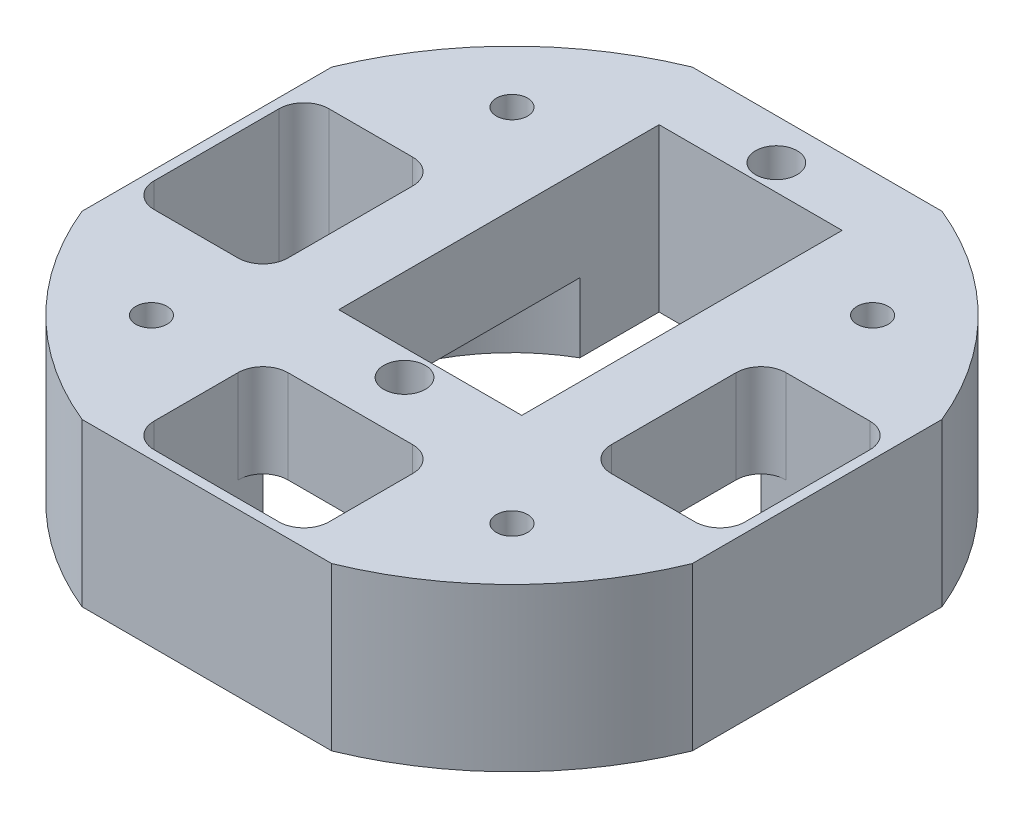
from build123d import *

# Parameters (mm, degrees)
SKETCH2_R           = 1.125
SKETCH2_R_2         = 1.5
SKETCH2_W           = 13.2
SKETCH2_H           = 23.1
BOSS_EXTRUDE3_DEPTH = 11.7
SKETCH2_9_R         = 1.5
CUT_EXTRUDE3_DEPTH  = 5
FILLET1_R           = 1.8


with BuildPart() as part:
    # Sketch2 → Boss-Extrude3 (new body)
    with BuildSketch(Plane(origin=(0, 0, 0), x_dir=(1, 0, 0), z_dir=(0, 1, 0))):
        with BuildLine():
            ThreePointArc((9, -22), (16.807736314, -16.807736314), (22, -9))
            Line((22, -9), (22, 9))
            ThreePointArc((22, 9), (16.807736314, 16.807736314), (9, 22))
            Line((9, 22), (-9, 22))
            ThreePointArc((-9, 22), (-16.807736314, 16.807736314), (-22, 9))
            Line((-22, 9), (-22, -9))
            ThreePointArc((-22, -9), (-16.807736314, -16.807736314), (-9, -22))
            Line((-9, -22), (9, -22))
        make_face()
        with BuildLine():
            Line((-6.3, -19.5), (-6.3, -11.65643599))
            Line((-6.3, -11.65643599), (6.3, -11.65643599))
            Line((6.3, -11.65643599), (6.3, -19.5))
            ThreePointArc((6.3, -19.5), (5.772792206, -20.772792206), (4.5, -21.3))
            Line((4.5, -21.3), (-4.5, -21.3))
            ThreePointArc((-4.5, -21.3), (-5.772792206, -20.772792206), (-6.3, -19.5))
        make_face(mode=Mode.SUBTRACT)
        with BuildLine():
            Line((-19.5, 6.3), (-11.65643599, 6.3))
            Line((-11.65643599, 6.3), (-11.65643599, -6.3))
            Line((-11.65643599, -6.3), (-19.5, -6.3))
            ThreePointArc((-19.5, -6.3), (-20.772792206, -5.772792206), (-21.3, -4.5))
            Line((-21.3, -4.5), (-21.3, 4.5))
            ThreePointArc((-21.3, 4.5), (-20.772792206, 5.772792206), (-19.5, 6.3))
        make_face(mode=Mode.SUBTRACT)
        with Locations((-13, -13)):
            Circle(SKETCH2_R, mode=Mode.SUBTRACT)
        with BuildLine():
            Line((11.65643599, -6.3), (11.65643599, 6.3))
            Line((11.65643599, 6.3), (19.5, 6.3))
            ThreePointArc((19.5, 6.3), (20.772792206, 5.772792206), (21.3, 4.5))
            Line((21.3, 4.5), (21.3, -4.5))
            ThreePointArc((21.3, -4.5), (20.772792206, -5.772792206), (19.5, -6.3))
            Line((19.5, -6.3), (11.65643599, -6.3))
        make_face(mode=Mode.SUBTRACT)
        with Locations((13, -13)):
            Circle(SKETCH2_R, mode=Mode.SUBTRACT)
        with Locations((0, -7.75)):
            Circle(SKETCH2_R_2, mode=Mode.SUBTRACT)
        with Locations((0, 5.655)):
            Rectangle(SKETCH2_W, SKETCH2_H, mode=Mode.SUBTRACT)
        with Locations((0, 19.06)):
            Circle(SKETCH2_R_2, mode=Mode.SUBTRACT)
        with Locations((-13, 13)):
            Circle(SKETCH2_R, mode=Mode.SUBTRACT)
        with Locations((13, 13)):
            Circle(SKETCH2_R, mode=Mode.SUBTRACT)
    extrude(amount=BOSS_EXTRUDE3_DEPTH)

    # Sketch2<9> → Cut-Extrude3 (cut)
    with BuildSketch(Plane(origin=(0, 0, 0), x_dir=(1, 0, 0), z_dir=(0, 1, 0))):
        with BuildLine():
            Line((-6.3, -11.65643599), (6.3, -11.65643599))
            ThreePointArc((6.3, -11.65643599), (9.369164851, -9.369164851), (11.65643599, -6.3))
            Line((11.65643599, -6.3), (11.65643599, 6.3))
            ThreePointArc((11.65643599, 6.3), (9.489805129, 9.246950774), (6.6, 11.489234091))
            Line((6.6, 11.489234091), (6.6, -5.895))
            Line((6.6, -5.895), (-6.6, -5.895))
            Line((-6.6, -5.895), (-6.6, 11.489234091))
            ThreePointArc((-6.6, 11.489234091), (-9.489805129, 9.246950774), (-11.65643599, 6.3))
            Line((-11.65643599, 6.3), (-11.65643599, -6.3))
            ThreePointArc((-11.65643599, -6.3), (-9.369164851, -9.369164851), (-6.3, -11.65643599))
        make_face()
        with Locations((0, -7.75)):
            Circle(SKETCH2_9_R, mode=Mode.SUBTRACT)
    extrude(amount=CUT_EXTRUDE3_DEPTH, mode=Mode.SUBTRACT)

    # Fillet1
    fillet1_edges = [part.edges().sort_by_distance(p)[0] for p in [
        (-11.65643599, 8.35, 6.3),
        (-11.65643599, 8.35, -6.3),
        (6.3, 8.35, 11.65643599),
        (-6.3, 8.35, 11.65643599),
        (11.65643599, 8.35, 6.3),
        (11.65643599, 8.35, -6.3),
    ]]
    fillet(fillet1_edges, radius=FILLET1_R)


solid = part.part
